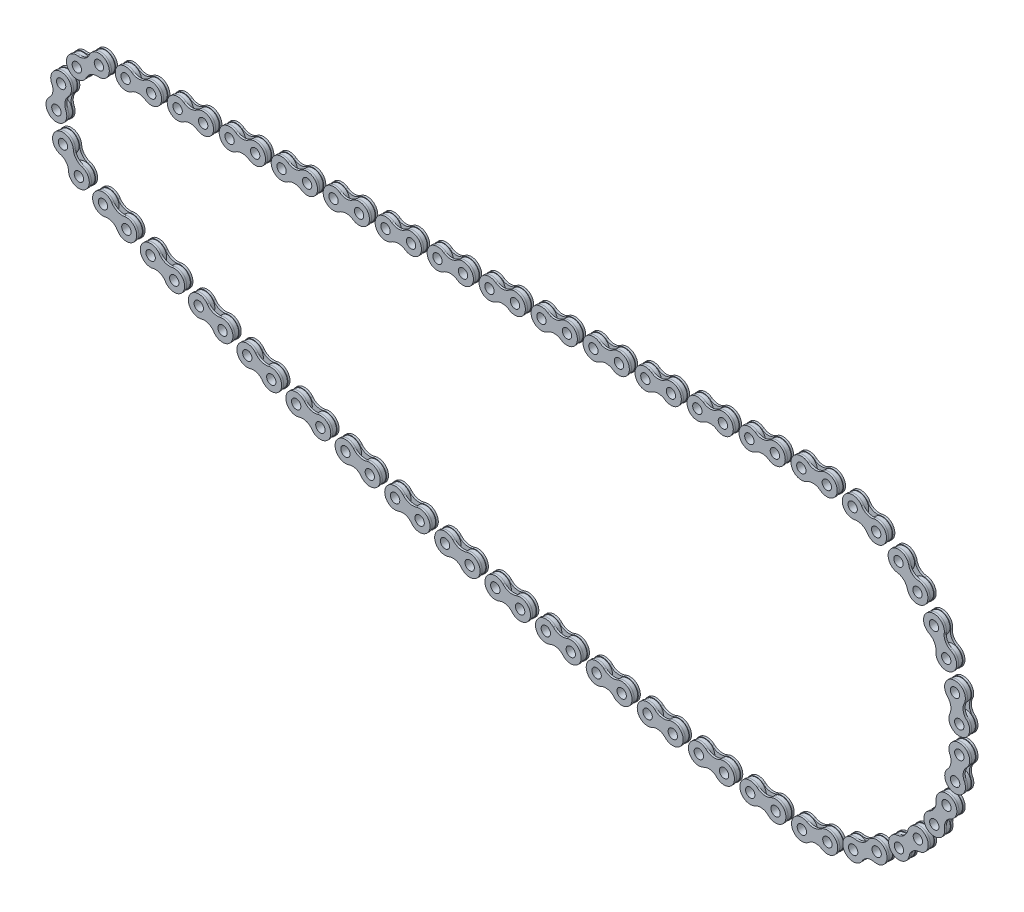
from build123d import *

# Parameters (mm, degrees)
SZKIC1_R                      = 4.75
SZKIC1_R_2                    = 2.25
DODANIE_WYCI_GNI_CIE1_DEPTH   = 1
DODANIE_WYCI_GNI_CIE1_2_DEPTH = 1
SZKIC2_R                      = 2.25
DODANIE_WYCI_GNI_CIE2_DEPTH   = 1
CRVPATTERN1_5_ANGLE           = 3.8901012
CRVPATTERN1_6_ANGLE           = 23.0027709
CRVPATTERN1_7_ANGLE           = 42.1154406
CRVPATTERN1_8_ANGLE           = 61.2281103
CRVPATTERN1_9_ANGLE           = 80.34078
CRVPATTERN1_10_ANGLE          = 99.4534497
CRVPATTERN1_11_ANGLE          = 118.5661194
CRVPATTERN1_12_ANGLE          = 137.6787891
CRVPATTERN1_13_ANGLE          = 156.7914588
CRVPATTERN1_14_ANGLE          = 175.9041285
CRVPATTERN1_15_ANGLE          = 172.3357403
CRVPATTERN1_16_ANGLE          = 171.095109
CRVPATTERN1_17_ANGLE          = 169.8544777
CRVPATTERN1_18_ANGLE          = 168.6138464
CRVPATTERN1_19_ANGLE          = 167.3732151
CRVPATTERN1_20_ANGLE          = 166.1325838
CRVPATTERN1_21_ANGLE          = 164.8919525
CRVPATTERN1_22_ANGLE          = 163.6513212
CRVPATTERN1_23_ANGLE          = 162.4106898
CRVPATTERN1_24_ANGLE          = 161.1700585
CRVPATTERN1_25_ANGLE          = 159.9294272
CRVPATTERN1_26_ANGLE          = 158.6887959
CRVPATTERN1_27_ANGLE          = 157.4481646
CRVPATTERN1_28_ANGLE          = 156.2075333
CRVPATTERN1_29_ANGLE          = 128.6116148
CRVPATTERN1_30_ANGLE          = 79.3521569
CRVPATTERN1_31_ANGLE          = 30.0926989


with BuildPart() as part:
    # Szkic1 → Dodanie-wyciągnięcie1 (new, symmetric)
    with BuildSketch(Plane.XY):
        with Locations((-6.15, 0)):
            Circle(SZKIC1_R)
        with Locations((-6.15, 0)):
            Circle(SZKIC1_R_2, mode=Mode.SUBTRACT)
    extrude(amount=DODANIE_WYCI_GNI_CIE1_DEPTH, both=True)



with BuildPart() as body_2:
    # Szkic1 → Dodanie-wyci_gni_cie1 2 (new, symmetric)
    with BuildSketch(Plane.XY):
        with Locations(Location((6.15, 0, 0), (0, 0, 180))):
            Circle(SZKIC1_R)
        with Locations((6.15, 0)):
            Circle(SZKIC1_R_2, mode=Mode.SUBTRACT)
    extrude(amount=DODANIE_WYCI_GNI_CIE1_2_DEPTH, both=True)


with BuildPart() as part_1:
    add(part.part)

    add(body_2.part)  # Dodanie-wyciągnięcie2 merges body 2
    # Szkic2 → Dodanie-wyciągnięcie2 (add)
    with BuildSketch(Plane.XY.offset(1)):
        with BuildLine():
            ThreePointArc((-3.148865835, 3.999149125), (-11.148695971, 0.114186637), (-3.334608396, -4.132017681))
            ThreePointArc((-3.334608396, -4.132017681), (0, -3.103961362), (3.334608396, -4.132017681))
            ThreePointArc((3.334608396, -4.132017681), (11.148695971, 0.114186637), (3.148865835, 3.999149125))
            ThreePointArc((3.148865835, 3.999149125), (0, 2.949031085), (-3.148865835, 3.999149125))
        make_face()
        with Locations((6.15, 0)):
            Circle(SZKIC2_R, mode=Mode.SUBTRACT)
        with Locations((-6.15, 0)):
            Circle(SZKIC2_R, mode=Mode.SUBTRACT)
    dodanie_wyci_gni_cie2 = extrude(amount=DODANIE_WYCI_GNI_CIE2_DEPTH)

    # Lustro1: Dodanie-wyciągnięcie2 across plane
    add(dodanie_wyci_gni_cie2.mirror(Plane.XY))


with BuildPart() as body_2_2:
    # CrvPattern1: read off the stored shape, not the designer's step
    # CrvPattern1: copy of part
    add(part_1.part.moved(Location((25.0184261, 0, 0))))


with BuildPart() as body_3:
    # CrvPattern1 2: copy of part
    add(part_1.part.moved(Location((50.0368522, 0, 0))))


with BuildPart() as body_4:
    # CrvPattern1 3: copy of part
    add(part_1.part.moved(Location((75.0552784, 0, 0))))


with BuildPart() as body_5:
    # CrvPattern1 4: copy of part
    add(part_1.part.moved(Location((100.0737045, 0, 0))))


with BuildPart() as body_6:
    # CrvPattern1 5: copy of part
    add(part_1.part.moved(Location((124.8126739, 8.3139814, 0))).rotate(Axis((0, 0, 0), (0, 0, -1)), CRVPATTERN1_5_ANGLE))


with BuildPart() as body_7:
    # CrvPattern1 6: copy of part
    add(part_1.part.moved(Location((139.7718616, 52.8577241, 0))).rotate(Axis((0, 0, 0), (0, 0, -1)), CRVPATTERN1_6_ANGLE))


with BuildPart() as body_8:
    # CrvPattern1 7: copy of part
    add(part_1.part.moved(Location((139.3216297, 99.8441009, 0))).rotate(Axis((0, 0, 0), (0, 0, -1)), CRVPATTERN1_7_ANGLE))


with BuildPart() as body_9:
    # CrvPattern1 8: copy of part
    add(part_1.part.moved(Location((123.5116151, 144.0930076, 0))).rotate(Axis((0, 0, 0), (0, 0, -1)), CRVPATTERN1_8_ANGLE))


with BuildPart() as body_10:
    # CrvPattern1 9: copy of part
    add(part_1.part.moved(Location((94.0848234, 180.7261379, 0))).rotate(Axis((0, 0, 0), (0, 0, -1)), CRVPATTERN1_9_ANGLE))


with BuildPart() as body_11:
    # CrvPattern1 10: copy of part
    add(part_1.part.moved(Location((54.2854682, 205.7048015, 0))).rotate(Axis((0, 0, 0), (0, 0, -1)), CRVPATTERN1_10_ANGLE))


with BuildPart() as body_12:
    # CrvPattern1 11: copy of part
    add(part_1.part.moved(Location((8.5013065, 216.2751772, 0))).rotate(Axis((0, 0, 0), (0, 0, -1)), CRVPATTERN1_11_ANGLE))


with BuildPart() as body_13:
    # CrvPattern1 12: copy of part
    add(part_1.part.moved(Location((-38.2200983, 211.2719134, 0))).rotate(Axis((0, 0, 0), (0, 0, -1)), CRVPATTERN1_12_ANGLE))


with BuildPart() as body_14:
    # CrvPattern1 13: copy of part
    add(part_1.part.moved(Location((-80.7278543, 191.2466047, 0))).rotate(Axis((0, 0, 0), (0, 0, -1)), CRVPATTERN1_13_ANGLE))


with BuildPart() as body_15:
    # CrvPattern1 14: copy of part
    add(part_1.part.moved(Location((-114.3356117, 158.4069801, 0))).rotate(Axis((0, 0, 0), (0, 0, -1)), CRVPATTERN1_14_ANGLE))


with BuildPart() as body_16:
    # CrvPattern1 15: copy of part
    add(part_1.part.moved(Location((-119.3081009, 133.3960802, 0))).rotate(Axis((0, 0, 0), (0, 0, 1)), CRVPATTERN1_15_ANGLE))


with BuildPart() as body_17:
    # CrvPattern1 16: copy of part
    add(part_1.part.moved(Location((-97.1515771, 131.052477, 0))).rotate(Axis((0, 0, 0), (0, 0, 1)), CRVPATTERN1_16_ANGLE))


with BuildPart() as body_18:
    # CrvPattern1 17: copy of part
    add(part_1.part.moved(Location((-74.9495048, 129.1891431, 0))).rotate(Axis((0, 0, 0), (0, 0, 1)), CRVPATTERN1_17_ANGLE))


with BuildPart() as body_19:
    # CrvPattern1 18: copy of part
    add(part_1.part.moved(Location((-52.7122933, 127.8069522, 0))).rotate(Axis((0, 0, 0), (0, 0, 1)), CRVPATTERN1_18_ANGLE))


with BuildPart() as body_20:
    # CrvPattern1 19: copy of part
    add(part_1.part.moved(Location((-30.4503682, 126.9065522, 0))).rotate(Axis((0, 0, 0), (0, 0, 1)), CRVPATTERN1_19_ANGLE))


with BuildPart() as body_21:
    # CrvPattern1 20: copy of part
    add(part_1.part.moved(Location((-8.1741669, 126.4883654, 0))).rotate(Axis((0, 0, 0), (0, 0, 1)), CRVPATTERN1_20_ANGLE))


with BuildPart() as body_22:
    # CrvPattern1 21: copy of part
    add(part_1.part.moved(Location((14.1058668, 126.5525878, 0))).rotate(Axis((0, 0, 0), (0, 0, 1)), CRVPATTERN1_21_ANGLE))


with BuildPart() as body_23:
    # CrvPattern1 22: copy of part
    add(part_1.part.moved(Location((36.3792872, 127.0991892, 0))).rotate(Axis((0, 0, 0), (0, 0, 1)), CRVPATTERN1_22_ANGLE))


with BuildPart() as body_24:
    # CrvPattern1 23: copy of part
    add(part_1.part.moved(Location((58.6356515, 128.1279134, 0))).rotate(Axis((0, 0, 0), (0, 0, 1)), CRVPATTERN1_23_ANGLE))


with BuildPart() as body_25:
    # CrvPattern1 24: copy of part
    add(part_1.part.moved(Location((80.8645252, 129.6382782, 0))).rotate(Axis((0, 0, 0), (0, 0, 1)), CRVPATTERN1_24_ANGLE))


with BuildPart() as body_26:
    # CrvPattern1 25: copy of part
    add(part_1.part.moved(Location((103.0554865, 131.6295753, 0))).rotate(Axis((0, 0, 0), (0, 0, 1)), CRVPATTERN1_25_ANGLE))


with BuildPart() as body_27:
    # CrvPattern1 26: copy of part
    add(part_1.part.moved(Location((125.1981314, 134.1008712, 0))).rotate(Axis((0, 0, 0), (0, 0, 1)), CRVPATTERN1_26_ANGLE))


with BuildPart() as body_28:
    # CrvPattern1 27: copy of part
    add(part_1.part.moved(Location((147.2820786, 137.0510072, 0))).rotate(Axis((0, 0, 0), (0, 0, 1)), CRVPATTERN1_27_ANGLE))


with BuildPart() as body_29:
    # CrvPattern1 28: copy of part
    add(part_1.part.moved(Location((169.2969743, 140.4786003, 0))).rotate(Axis((0, 0, 0), (0, 0, 1)), CRVPATTERN1_28_ANGLE))


with BuildPart() as body_30:
    # CrvPattern1 29: copy of part
    add(part_1.part.moved(Location((108.2250548, 211.2823936, 0))).rotate(Axis((0, 0, 0), (0, 0, 1)), CRVPATTERN1_29_ANGLE))


with BuildPart() as body_31:
    # CrvPattern1 30: copy of part
    add(part_1.part.moved(Location((-67.3927872, 230.002499, 0))).rotate(Axis((0, 0, 0), (0, 0, 1)), CRVPATTERN1_30_ANGLE))


with BuildPart() as body_32:
    # CrvPattern1 31: copy of part
    add(part_1.part.moved(Location((-196.1907965, 109.1590398, 0))).rotate(Axis((0, 0, 0), (0, 0, 1)), CRVPATTERN1_31_ANGLE))


with BuildPart() as body_33:
    # CrvPattern1 32: copy of part
    add(part_1.part.moved(Location((-200.147409, 0, 0))))


with BuildPart() as body_34:
    # CrvPattern1 33: copy of part
    add(part_1.part.moved(Location((-175.1289829, 0, 0))))


with BuildPart() as body_35:
    # CrvPattern1 34: copy of part
    add(part_1.part.moved(Location((-150.1105567, 0, 0))))


with BuildPart() as body_36:
    # CrvPattern1 35: copy of part
    add(part_1.part.moved(Location((-125.0921306, 0, 0))))


with BuildPart() as body_37:
    # CrvPattern1 36: copy of part
    add(part_1.part.moved(Location((-100.0737045, 0, 0))))


with BuildPart() as body_38:
    # CrvPattern1 37: copy of part
    add(part_1.part.moved(Location((-75.0552784, 0, 0))))


with BuildPart() as body_39:
    # CrvPattern1 38: copy of part
    add(part_1.part.moved(Location((-50.0368522, 0, 0))))


with BuildPart() as body_40:
    # CrvPattern1 39: copy of part
    add(part_1.part.moved(Location((-25.0184261, 0, 0))))


solid = Compound([part_1.part, body_2_2.part, body_3.part, body_4.part, body_5.part, body_6.part, body_7.part, body_8.part, body_9.part, body_10.part, body_11.part, body_12.part, body_13.part, body_14.part, body_15.part, body_16.part, body_17.part, body_18.part, body_19.part, body_20.part, body_21.part, body_22.part, body_23.part, body_24.part, body_25.part, body_26.part, body_27.part, body_28.part, body_29.part, body_30.part, body_31.part, body_32.part, body_33.part, body_34.part, body_35.part, body_36.part, body_37.part, body_38.part, body_39.part, body_40.part])
